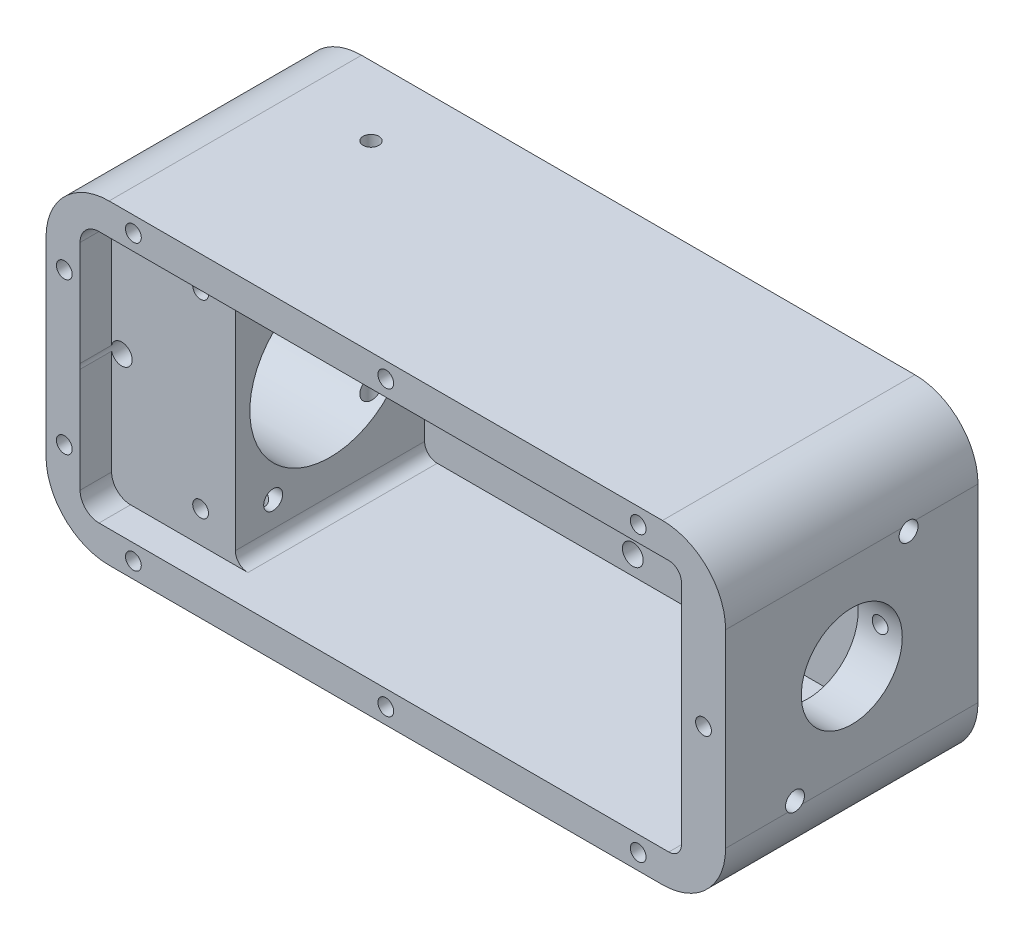
from build123d import *

# Parameters (mm, degrees)
SKETCH1_W                  = 107.7
SKETCH1_H                  = 50
BOSS_EXTRUDE1_DEPTH        = 40
SKETCH2_W                  = 75.7
SKETCH2_H                  = 40
CUT_EXTRUDE1_DEPTH         = 35
CUT_EXTRUDE2_REACH         = 125.791
SKETCH4_W                  = 19.6
SKETCH4_H                  = 40
SKETCH5_W                  = 45
SKETCH5_H                  = 10.3
CUT_EXTRUDE3_DEPTH         = 126.296807621
F_4_CLEARANCE_HOLE1_D      = 3.3
F_4_CLEARANCE_HOLE1_DEPTH  = 40
F_4_CLEARANCE_HOLE2_D      = 3.3
F_4_CLEARANCE_HOLE2_DEPTH  = 10
F_3_CLEARANCE_HOLE1_D      = 3
F_3_CLEARANCE_HOLE1_DEPTH  = 7
F_3_CLEARANCE_HOLE2_D      = 3
F_3_CLEARANCE_HOLE2_DEPTH  = 7
F_2_CLEARANCE_HOLE1_D      = 2.5
HOLE1_D                    = 16
HOLE1_DEPTH                = 7
F_2_CLEARANCE_HOLE2_D      = 2.5
F_2_CLEARANCE_HOLE2_DEPTH  = 52.098259685
F_3_CLEARANCE_HOLE3_D      = 3
F_3_CLEARANCE_HOLE3_DEPTH  = 107.7
F_2_CLEARANCE_HOLE3_D      = 2.5
F_2_CLEARANCE_HOLE3_DEPTH  = 10
F_2_CLEARANCE_HOLE4_REACH  = 127.297
F_2_CLEARANCE_HOLE4_BORE_R = 1.25
F_1_1_DIAMETER_HOLE1_D     = 25.4
F_1_1_DIAMETER_HOLE1_DEPTH = 25
SKETCH28_W                 = 1.65
SKETCH28_H                 = 40
F_2_CLEARANCE_HOLE5_D      = 2.5
F_2_CLEARANCE_HOLE5_DEPTH  = 10
FILLET1_R                  = 2
FILLET2_R                  = 3
FILLET3_R                  = 10


with BuildPart() as part:
    # Sketch1 → Boss-Extrude1 (new body)
    with BuildSketch(Plane.XY.offset(40)):
        with Locations((53.85, -25)):
            Rectangle(SKETCH1_W, SKETCH1_H)
    extrude(amount=-BOSS_EXTRUDE1_DEPTH)

    # Sketch2 → Cut-Extrude1 (cut)
    with BuildSketch(Plane.XY.offset(40)):
        with Locations((62.85, -25)):
            Rectangle(SKETCH2_W, SKETCH2_H)
    extrude(amount=-CUT_EXTRUDE1_DEPTH, mode=Mode.SUBTRACT)

    # Sketch4 → Cut-Extrude2 (cut, up to next)
    with BuildSketch(Plane(origin=(0, 0, 35), x_dir=(-1, 0, 0), z_dir=(0, 0, -1)), mode=Mode.PRIVATE) as cut_extrude2_sk1:
        with Locations((-15.2, -25)):
            Rectangle(SKETCH4_W, SKETCH4_H)
    cut_extrude2_tool1 = extrude(cut_extrude2_sk1.sketch, amount=-CUT_EXTRUDE2_REACH, mode=Mode.PRIVATE) & part.part
    add(cut_extrude2_tool1.solids().sort_by_distance((15.2, -25, 35))[0], mode=Mode.SUBTRACT)

    # Sketch5 → Cut-Extrude3 (cut, through all)
    with BuildSketch(Plane(origin=(0, 0, 0), x_dir=(-1, 0, 0), z_dir=(0, 0, -1))):
        with Locations((-77.2, -25)):
            Rectangle(SKETCH5_W, SKETCH5_H)
    extrude(amount=-CUT_EXTRUDE3_DEPTH, mode=Mode.SUBTRACT)

    # #4 Clearance Hole1
    with Locations(Plane(origin=(0, 0, 0), x_dir=(-1, 0, 0), z_dir=(0, 0, -1))):
        with Locations((-58, -42), (-78, -42), (-98, -42), (-98, -8), (-58, -8), (-78, -8)):
            Hole(F_4_CLEARANCE_HOLE1_D / 2, depth=F_4_CLEARANCE_HOLE1_DEPTH)

    # #4 Clearance Hole2
    with Locations(Plane(origin=(0, 0, 0), x_dir=(-1, 0, 0), z_dir=(0, 0, -1))):
        with Locations((-8, -8)):
            Hole(F_4_CLEARANCE_HOLE2_D / 2, depth=F_4_CLEARANCE_HOLE2_DEPTH)

    # #3 Clearance Hole1
    with Locations(Plane(origin=(107.7, 0, 0), x_dir=(0, 0, -1), z_dir=(1, 0, 0))):
        with Locations((-29, -39)):
            Hole(F_3_CLEARANCE_HOLE1_D / 2, depth=F_3_CLEARANCE_HOLE1_DEPTH)

    # #3 Clearance Hole2
    with Locations(Plane.ZY.offset(-100.7)):
        with Locations((11, -11)):
            Hole(F_3_CLEARANCE_HOLE2_D / 2, depth=F_3_CLEARANCE_HOLE2_DEPTH)

    # #2 Clearance Hole1 (through all)
    with Locations(Plane(origin=(0, 0, 0), x_dir=(1, 0, 0), z_dir=(0, 1, 0))):
        with Locations((22.5, -11)):
            Hole(F_2_CLEARANCE_HOLE1_D / 2)

    # Hole1
    with Locations(Plane(origin=(107.7, 0, 0), x_dir=(0, 0, -1), z_dir=(1, 0, 0))):
        with Locations((-20, -25)):
            Hole(HOLE1_D / 2, depth=HOLE1_DEPTH)

    # #2 Clearance Hole2
    with Locations(Plane.XY.offset(40)):
        with Locations((104.2, -25)):
            Hole(F_2_CLEARANCE_HOLE2_D / 2, depth=F_2_CLEARANCE_HOLE2_DEPTH)

    # #3 Clearance Hole3
    with Locations(Plane.ZY):
        with Locations((29, -39), (11, -11)):
            Hole(F_3_CLEARANCE_HOLE3_D / 2, depth=F_3_CLEARANCE_HOLE3_DEPTH)

    # #2 Clearance Hole3
    with Locations(Plane.XY.offset(40)):
        with Locations((2.9, -37), (93.85, -2.5), (53.85, -2.5), (13.85, -2.5), (2.9, -13), (13.85, -47.5), (53.85, -47.5), (93.85, -47.5)):
            Hole(F_2_CLEARANCE_HOLE3_D / 2, depth=F_2_CLEARANCE_HOLE3_DEPTH)

    # #2 Clearance Hole4 bore → #2 Clearance Hole4 (cut, up to next)
    with BuildSketch(Plane(origin=(0, -50, 0), x_dir=(-1, 0, 0), z_dir=(0, -1, 0)), mode=Mode.PRIVATE) as f_2_clearance_hole4_sk1:
        with Locations((-22.5, -29)):
            Circle(F_2_CLEARANCE_HOLE4_BORE_R)
    f_2_clearance_hole4_tool1 = extrude(f_2_clearance_hole4_sk1.sketch, amount=-F_2_CLEARANCE_HOLE4_REACH, mode=Mode.PRIVATE) & part.part
    add(f_2_clearance_hole4_tool1.solids().sort_by_distance((22.5, -50, 29))[0], mode=Mode.SUBTRACT)

    # 1 (1) Diameter Hole1
    with Locations(Plane(origin=(25, 0, 0), x_dir=(0, 0, -1), z_dir=(1, 0, 0))):
        with Locations((-20, -25)):
            Hole(F_1_1_DIAMETER_HOLE1_D / 2, depth=F_1_1_DIAMETER_HOLE1_DEPTH)

    # Sketch28 → #4 Clearance Hole3 (revolve, cut)
    with BuildSketch(Plane(origin=(7, -25, 32.592358794), x_dir=(0, 1, 0), z_dir=(1, 0, 0))):
        with Locations((0.825, 20)):
            Rectangle(SKETCH28_W, SKETCH28_H)
    revolve(axis=Axis((7, -25, 26.242358794), (0, 0, 1)), mode=Mode.SUBTRACT)

    # #2 Clearance Hole5
    with Locations(Plane.XY.offset(35)):
        with Locations((19.5, -10), (19.5, -40)):
            Hole(F_2_CLEARANCE_HOLE5_D / 2, depth=F_2_CLEARANCE_HOLE5_DEPTH)

    # Fillet1
    fillet1_edges = [part.edges().sort_by_distance(p)[0] for p in [
        (100.7, -5, 22.5),
        (100.7, -45, 22.5),
        (25, -45, 20),
        (25, -5, 20),
        (99.7, -19.85, 2.5),
        (54.7, -19.85, 2.5),
        (54.7, -30.15, 2.5),
        (99.7, -30.15, 2.5),
    ]]
    fillet(fillet1_edges, radius=FILLET1_R)

    # Fillet2
    fillet2_edges = [part.edges().sort_by_distance(p)[0] for p in [
        (5.4, -5, 37.5),
        (5.4, -45, 37.5),
    ]]
    fillet(fillet2_edges, radius=FILLET2_R)

    # Fillet3
    # the kernel refuses this fillet: 10 mm, written as the material it takes off along each edge
    with BuildSketch(Plane(origin=(107.7, 0, 65), x_dir=(-1, 0, 0), z_dir=(0, 0, -1)), Plane(origin=(0, 0, 65), x_dir=(0, -1, 0), z_dir=(0, 0, -1))) as fillet3_piece_1:
        with BuildLine():
            CenterArc((FILLET3_R, -FILLET3_R), FILLET3_R, 90, 90)
            Line((0, -FILLET3_R), (0, 0))
            Line((0, 0), (FILLET3_R, 0))
        make_face()
    extrude(amount=90, mode=Mode.SUBTRACT)
    with BuildSketch(Plane(origin=(107.7, -50, 65), x_dir=(-1, 0, 0), z_dir=(0, 0, -1)), Plane(origin=(0, -50, 65), x_dir=(0, 1, 0), z_dir=(0, 0, -1))) as fillet3_piece_2:
        with BuildLine():
            CenterArc((FILLET3_R, FILLET3_R), FILLET3_R, 180, 90)
            Line((0, FILLET3_R), (0, 0))
            Line((0, 0), (FILLET3_R, 0))
        make_face()
    extrude(amount=90, mode=Mode.SUBTRACT)


solid = part.part
